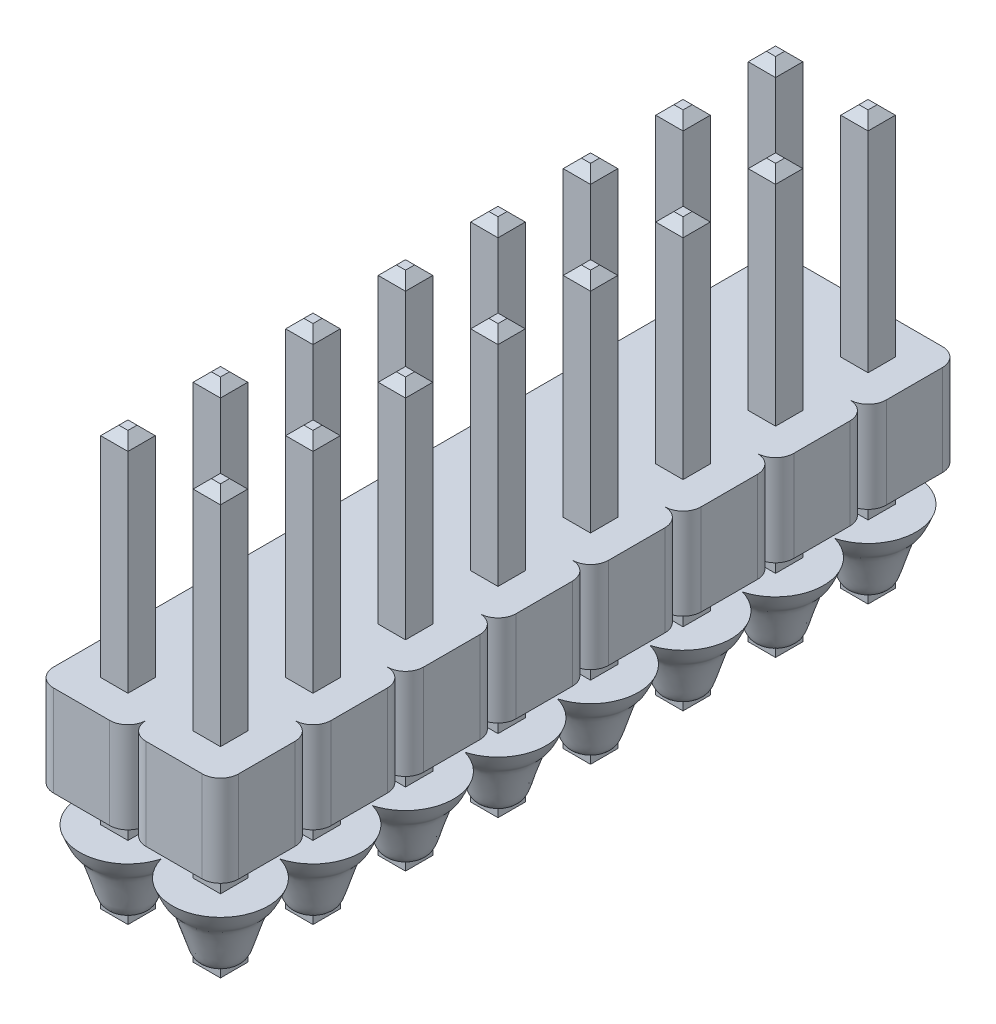
from build123d import *

# Parameters (mm, degrees)
BOSS_EXTRUDE1_DEPTH        = 2.5
LPATTERN1_COUNT            = 8
LPATTERN1_PITCH            = 2.54
LPATTERN1_COUNT_DIR2       = 2
LPATTERN1_PITCH_DIR2       = 2.54
BOSS_EXTRUDE2_START        = -3.25
SKETCH2_W                  = 0.75
SKETCH2_H                  = 0.75
BOSS_EXTRUDE2_DEPTH        = 11.75
CHAMFER1_SIZE              = 0.25
LPATTERN2_COUNT            = 8
LPATTERN2_PITCH            = 2.54
LPATTERN2_COUNT_DIR2       = 2
LPATTERN2_PITCH_DIR2       = 2.54
CHAMFER1_OF_LPATTERN2_SIZE = 0.25
PADR_O_LINEAR1_COUNT       = 8
PADR_O_LINEAR1_PITCH       = 2.54
PADR_O_LINEAR1_COUNT_DIR2  = 2
PADR_O_LINEAR1_PITCH_DIR2  = 2.54


with BuildPart() as part:
    # Sketch1 → Boss-Extrude1 (new body)
    with BuildSketch(Plane(origin=(0, 0, 0), x_dir=(-1, 0, 0), z_dir=(0, 1, 0))):
        with BuildLine():
            Line((-0.77, 1.27), (0.77, 1.27))
            ThreePointArc((0.77, 1.27), (1.123553391, 1.123553391), (1.27, 0.77))
            Line((1.27, 0.77), (1.27, -0.77))
            ThreePointArc((1.27, -0.77), (1.123553391, -1.123553391), (0.77, -1.27))
            Line((0.77, -1.27), (-0.77, -1.27))
            ThreePointArc((-0.77, -1.27), (-1.123553391, -1.123553391), (-1.27, -0.77))
            Line((-1.27, -0.77), (-1.27, 0.77))
            ThreePointArc((-1.27, 0.77), (-1.123553391, 1.123553391), (-0.77, 1.27))
        make_face()
    boss_extrude1 = extrude(amount=BOSS_EXTRUDE1_DEPTH)

    # LPattern1: Boss-Extrude1 8 × 2
    with Locations(*[(j * LPATTERN1_PITCH_DIR2, 0, i * LPATTERN1_PITCH) for i in range(LPATTERN1_COUNT) for j in range(LPATTERN1_COUNT_DIR2) if (i, j) != (0, 0)]):
        add(boss_extrude1)

    # Sketch2 → Boss-Extrude2 (add)
    with BuildSketch(Plane(origin=(0, 0, 0), x_dir=(-1, 0, 0), z_dir=(0, 1, 0)).offset(BOSS_EXTRUDE2_START)):
        Rectangle(SKETCH2_W, SKETCH2_H)
    boss_extrude2 = extrude(amount=BOSS_EXTRUDE2_DEPTH)

    # Chamfer1
    chamfer1_edges = [part.edges().sort_by_distance(p)[0] for p in [
        (0.375, -3.25, 0),
        (0, -3.25, 0.375),
        (-0.375, -3.25, 0),
        (0, -3.25, -0.375),
        (0.375, 8.5, 0),
        (0, 8.5, -0.375),
        (-0.375, 8.5, 0),
        (0, 8.5, 0.375),
    ]]
    chamfer(chamfer1_edges, length=CHAMFER1_SIZE)

    # LPattern2: Boss-Extrude2 8 × 2
    with Locations(*[(j * LPATTERN2_PITCH_DIR2, 0, i * LPATTERN2_PITCH) for i in range(LPATTERN2_COUNT) for j in range(LPATTERN2_COUNT_DIR2) if (i, j) != (0, 0)]):
        add(boss_extrude2)

    # Chamfer1 of LPattern2
    chamfer1_of_lpattern2_edges = [part.edges().sort_by_distance(p)[0] for p in [
        (2.915, -3.25, 0),
        (2.54, -3.25, 0.375),
        (2.165, -3.25, 0),
        (2.54, -3.25, -0.375),
        (2.915, 8.5, 0),
        (2.54, 8.5, -0.375),
        (2.165, 8.5, 0),
        (2.54, 8.5, 0.375),
        (0.375, -3.25, 2.54),
        (0, -3.25, 2.915),
        (-0.375, -3.25, 2.54),
        (0, -3.25, 2.165),
        (0.375, 8.5, 2.54),
        (0, 8.5, 2.165),
        (-0.375, 8.5, 2.54),
        (0, 8.5, 2.915),
        (2.915, -3.25, 2.54),
        (2.54, -3.25, 2.915),
        (2.165, -3.25, 2.54),
        (2.54, -3.25, 2.165),
        (2.915, 8.5, 2.54),
        (2.54, 8.5, 2.165),
        (2.165, 8.5, 2.54),
        (2.54, 8.5, 2.915),
        (0.375, -3.25, 5.08),
        (0, -3.25, 5.455),
        (-0.375, -3.25, 5.08),
        (0, -3.25, 4.705),
        (0.375, 8.5, 5.08),
        (0, 8.5, 4.705),
        (-0.375, 8.5, 5.08),
        (0, 8.5, 5.455),
        (2.915, -3.25, 5.08),
        (2.54, -3.25, 5.455),
        (2.165, -3.25, 5.08),
        (2.54, -3.25, 4.705),
        (2.915, 8.5, 5.08),
        (2.54, 8.5, 4.705),
        (2.165, 8.5, 5.08),
        (2.54, 8.5, 5.455),
        (0.375, -3.25, 7.62),
        (0, -3.25, 7.995),
        (-0.375, -3.25, 7.62),
        (0, -3.25, 7.245),
        (0.375, 8.5, 7.62),
        (0, 8.5, 7.245),
        (-0.375, 8.5, 7.62),
        (0, 8.5, 7.995),
        (2.915, -3.25, 7.62),
        (2.54, -3.25, 7.995),
        (2.165, -3.25, 7.62),
        (2.54, -3.25, 7.245),
        (2.915, 8.5, 7.62),
        (2.54, 8.5, 7.245),
        (2.165, 8.5, 7.62),
        (2.54, 8.5, 7.995),
        (0.375, -3.25, 10.16),
        (0, -3.25, 10.535),
        (-0.375, -3.25, 10.16),
        (0, -3.25, 9.785),
        (0.375, 8.5, 10.16),
        (0, 8.5, 9.785),
        (-0.375, 8.5, 10.16),
        (0, 8.5, 10.535),
        (2.915, -3.25, 10.16),
        (2.54, -3.25, 10.535),
        (2.165, -3.25, 10.16),
        (2.54, -3.25, 9.785),
        (2.915, 8.5, 10.16),
        (2.54, 8.5, 9.785),
        (2.165, 8.5, 10.16),
        (2.54, 8.5, 10.535),
        (0.375, -3.25, 12.7),
        (0, -3.25, 13.075),
        (-0.375, -3.25, 12.7),
        (0, -3.25, 12.325),
        (0.375, 8.5, 12.7),
        (0, 8.5, 12.325),
        (-0.375, 8.5, 12.7),
        (0, 8.5, 13.075),
        (2.915, -3.25, 12.7),
        (2.54, -3.25, 13.075),
        (2.165, -3.25, 12.7),
        (2.54, -3.25, 12.325),
        (2.915, 8.5, 12.7),
        (2.54, 8.5, 12.325),
        (2.165, 8.5, 12.7),
        (2.54, 8.5, 13.075),
        (0.375, -3.25, 15.24),
        (0, -3.25, 15.615),
        (-0.375, -3.25, 15.24),
        (0, -3.25, 14.865),
        (0.375, 8.5, 15.24),
        (0, 8.5, 14.865),
        (-0.375, 8.5, 15.24),
        (0, 8.5, 15.615),
        (2.915, -3.25, 15.24),
        (2.54, -3.25, 15.615),
        (2.165, -3.25, 15.24),
        (2.54, -3.25, 14.865),
        (2.915, 8.5, 15.24),
        (2.54, 8.5, 14.865),
        (2.165, 8.5, 15.24),
        (2.54, 8.5, 15.615),
        (0.375, -3.25, 17.78),
        (0, -3.25, 18.155),
        (-0.375, -3.25, 17.78),
        (0, -3.25, 17.405),
        (0.375, 8.5, 17.78),
        (0, 8.5, 17.405),
        (-0.375, 8.5, 17.78),
        (0, 8.5, 18.155),
        (2.915, -3.25, 17.78),
        (2.54, -3.25, 18.155),
        (2.165, -3.25, 17.78),
        (2.54, -3.25, 17.405),
        (2.915, 8.5, 17.78),
        (2.54, 8.5, 17.405),
        (2.165, 8.5, 17.78),
        (2.54, 8.5, 18.155),
    ]]
    chamfer(chamfer1_of_lpattern2_edges, length=CHAMFER1_OF_LPATTERN2_SIZE)

    # Esboço1 → Revolução2 (revolve)
    with BuildSketch(Plane(origin=(0, 0, 0), x_dir=(-1, 0, 0), z_dir=(0, 0, -1))):
        with BuildLine():
            Line((-1.320204823, -1), (0, -1))
            Line((0, -1), (0, -3))
            add(Edge.make_bspline(
                [(0, -3), (-0.545354241, -2.805125214), (-0.546680264, -2.896676866), (-1.037676718, -1.238977036), (-1.044410545, -1.709392138), (-1.320204823, -1)],
                knots=[0, 0, 0, 0, 0.399820066, 0.605692829, 1, 1, 1, 1], degree=3))
        make_face()
    revolu_o2 = revolve(axis=Axis((0, -3.204155831, 0), (0, 1, 0)))

    # Padrão linear1: Revolu_o2 8 × 2
    with Locations(*[(j * PADR_O_LINEAR1_PITCH_DIR2, 0, i * PADR_O_LINEAR1_PITCH) for i in range(PADR_O_LINEAR1_COUNT) for j in range(PADR_O_LINEAR1_COUNT_DIR2) if (i, j) != (0, 0)]):
        add(revolu_o2)


solid = part.part
